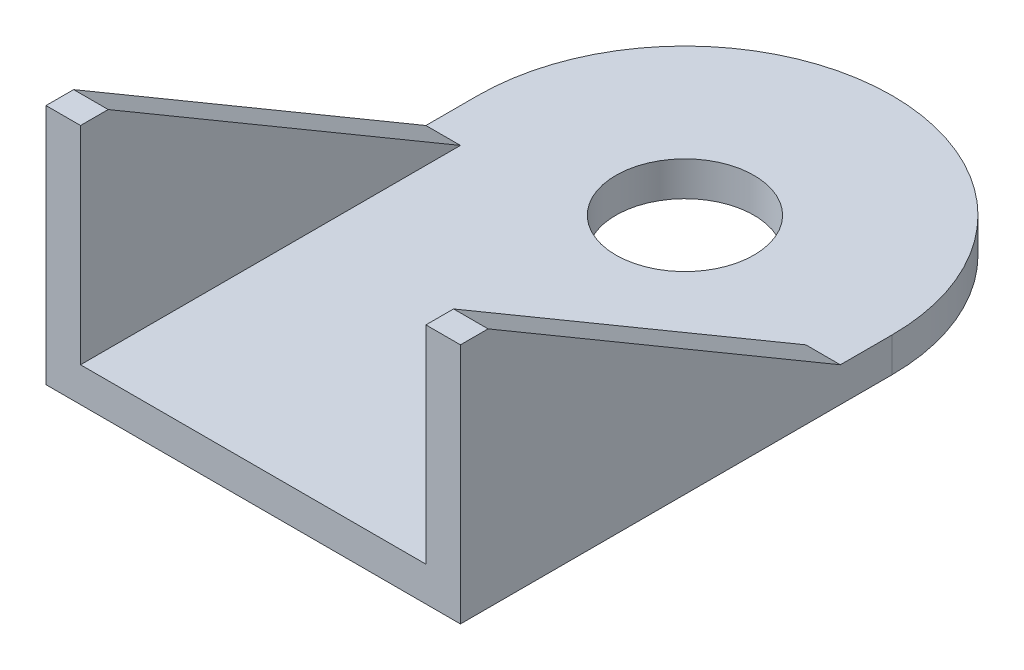
from build123d import *

# Parameters (mm, degrees)
SKETCH_1_R      = 4
EXTRUDE_1_DEPTH = 2
EXTRUDE_2_DEPTH = 2


with BuildPart() as part:
    # 草图1 → 凸台-拉伸1 (new body)
    with BuildSketch(Plane(origin=(0, 0, 0), x_dir=(1, 0, 0), z_dir=(0, 1, 0))):
        with BuildLine():
            Line((12, -25), (12, 0))
            ThreePointArc((12, 0), (0, 12), (-12, 0))
            Line((-12, 0), (-12, -25))
            Line((-12, -25), (12, -25))
        make_face()
        Circle(SKETCH_1_R, mode=Mode.SUBTRACT)
    extrude(amount=EXTRUDE_1_DEPTH)

    # 草图3 → 凸台-拉伸2 (add)
    with BuildSketch(Plane(origin=(12, 0, 0), x_dir=(0, 0, -1), z_dir=(1, 0, 0))):
        Polygon((-25, 2), (-25, 14), (-23.4, 14), (-3, 2), align=None)
    extrude_2 = extrude(amount=-EXTRUDE_2_DEPTH)

    # 镜向1: 凸台-拉伸2 across plane
    add(extrude_2.mirror(Plane(origin=(0, 0, 0), x_dir=(0, 0, 1), z_dir=(1, 0, 0))))


solid = part.part
